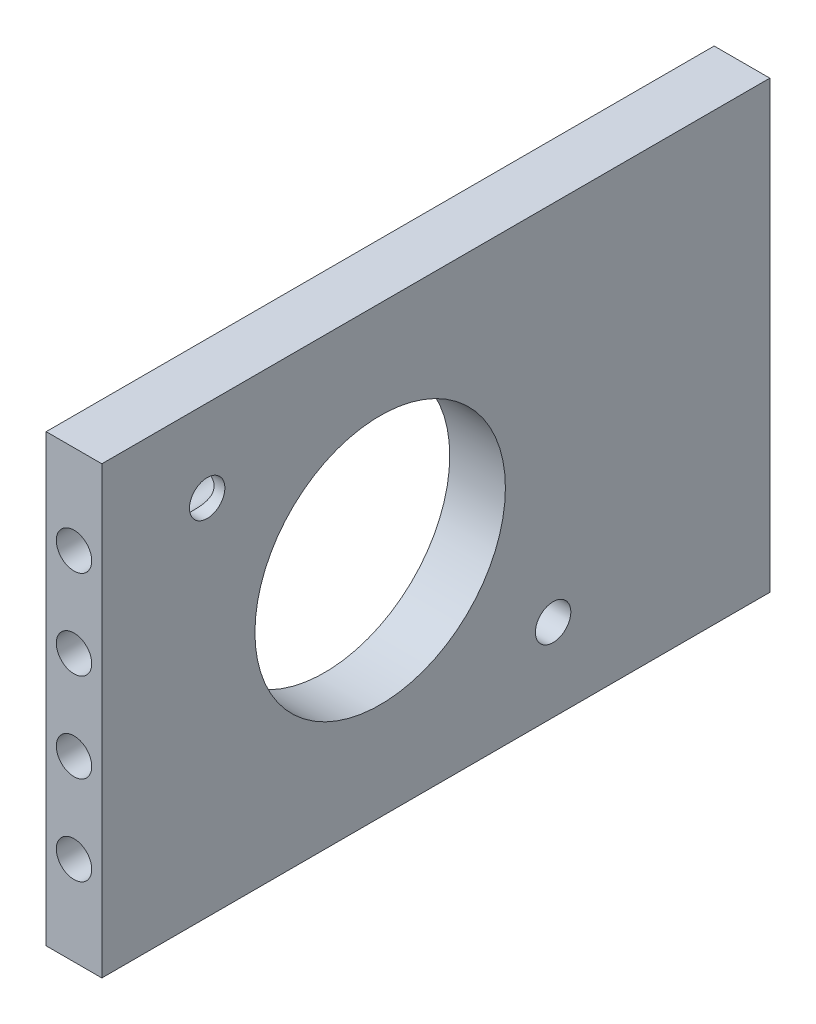
from build123d import *

# Parameters (mm, degrees)
SKETCH2_W                  = 76.2
SKETCH2_H                  = 50.8
BOSS_EXTRUDE2_DEPTH        = 6.35
F_10_32_TAPPED_HOLE1_D     = 4.0386
F_10_32_TAPPED_HOLE1_DEPTH = 25.4
F_10_32_TAPPED_HOLE1_TIP   = 1.213317848
SKETCH6_R                  = 14.2875
CUT_EXTRUDE1_DEPTH         = 47.228697797
F_10_32_TAPPED_HOLE2_D     = 4.0386
F_10_32_TAPPED_HOLE2_DEPTH = 12.02944
F_10_32_TAPPED_HOLE2_TIP   = 1.213317848


with BuildPart() as part:
    # Sketch2 → Boss-Extrude2 (new body)
    with BuildSketch(Plane(origin=(0, 0, 0), x_dir=(0, 0, -1), z_dir=(1, 0, 0))):
        Rectangle(SKETCH2_W, SKETCH2_H)
    extrude(amount=BOSS_EXTRUDE2_DEPTH)

    # #10-32 Tapped Hole1
    with Locations(Plane.XY.offset(38.1)):
        with Locations((3.175, -15.24), (3.175, -5.08), (3.175, 5.08), (3.175, 15.24)):
            Hole(F_10_32_TAPPED_HOLE1_D / 2, depth=F_10_32_TAPPED_HOLE1_DEPTH)
            with Locations((0, 0, -(F_10_32_TAPPED_HOLE1_DEPTH + F_10_32_TAPPED_HOLE1_TIP / 2))):  # 118° drill point
                Cone(0, F_10_32_TAPPED_HOLE1_D / 2, F_10_32_TAPPED_HOLE1_TIP, mode=Mode.SUBTRACT)

    # Sketch6 → Cut-Extrude1 (cut, through all)
    with BuildSketch(Plane(origin=(6.35, 0, 0), x_dir=(0, 0, -1), z_dir=(1, 0, 0))):
        with Locations((-6.35, 0)):
            Circle(SKETCH6_R)
    extrude(amount=-CUT_EXTRUDE1_DEPTH, mode=Mode.SUBTRACT)

    # #10-32 Tapped Hole2
    with Locations(Plane.ZY):
        with Locations((26.086327021, 16.008203771), (-13.37726374, -15.98030986)):
            Hole(F_10_32_TAPPED_HOLE2_D / 2, depth=F_10_32_TAPPED_HOLE2_DEPTH)
            with Locations((0, 0, -(F_10_32_TAPPED_HOLE2_DEPTH + F_10_32_TAPPED_HOLE2_TIP / 2))):  # 118° drill point
                Cone(0, F_10_32_TAPPED_HOLE2_D / 2, F_10_32_TAPPED_HOLE2_TIP, mode=Mode.SUBTRACT)


solid = part.part
